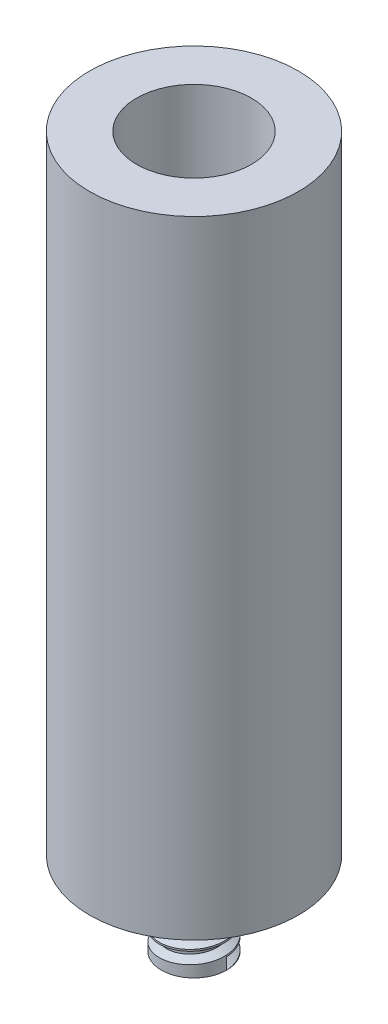
from build123d import *

# Parameters (mm, degrees)
FILETAGE1_PITCH = 1.27


with BuildPart() as part:
    # Esquisse1 → Revolve V1 (revolve)
    with BuildSketch(Plane.XY, mode=Mode.PRIVATE) as revolve_v1_sk:
        Polygon((0, 0), (0, 8), (-6.875, 8), (-6.875, 68), (-2.375, 68), (-2.375, 23), (3.125, 23), (3.125, 0), align=None)
    revolve(revolve_v1_sk.sketch.rotate(Axis((3.125, 0, 0), (0, 1, 0)), 270), axis=Axis((3.125, 0, 0), (0, 1, 0)))

    # Filetage1: arcs per turn and ends read off the stored shape
    # Filetage1: the profile of Profil de filetage1 profile screwed along a right-hand helix through 5.511814 turns, 8 arcs to a turn; built about Z, then put on its axis
    filetage1_z = Axis((0, 0, 0), (0, 0, 1))
    filetage1_corners = [(3.1253, 0, -0.000173205), (3.1253, 0, 1.111423202), (2.437592339, 0, 0.714374998), (2.437592339, 0, 0.396874998)]
    with BuildLine(mode=Mode.PRIVATE) as filetage1_profile:
        Line(filetage1_corners[0], filetage1_corners[1])
        Line(filetage1_corners[1], filetage1_corners[2])
        Line(filetage1_corners[2], filetage1_corners[3])
        Line(filetage1_corners[3], filetage1_corners[0])
    filetage1_cap = Face(filetage1_profile.wire())
    filetage1_turn_angles = [0, 22.5, 45, 67.5, 90, 112.5, 135, 157.5, 180, 202.5, 225, 247.5, 270, 292.5, 315, 337.5, 360]
    filetage1_turn_weights = [1, 0.9238795325112867, 1, 0.9238795325112867, 1, 0.9238795325112867, 1, 0.9238795325112867, 1, 0.9238795325112867, 1, 0.9238795325112867, 1, 0.9238795325112867, 1, 0.9238795325112867, 1]
    filetage1_turn_rails = [Edge.make_bspline([Vector(p[0], p[1], 0).rotate(filetage1_z, filetage1_turn_angles[k]) / filetage1_turn_weights[k] + Vector(0, 0, p[2] + FILETAGE1_PITCH * filetage1_turn_angles[k] / 360) for k in range(17)], [0, 0, 0, 1, 1, 2, 2, 3, 3, 4, 4, 5, 5, 6, 6, 7, 7, 8, 8, 8], 2, filetage1_turn_weights) for p in filetage1_corners]
    filetage1_turn_sides = [Face.make_surface_from_curves(filetage1_turn_rails[p[0]], filetage1_turn_rails[p[1]]) for p in [(0, 1), (1, 2), (2, 3), (3, 0)]]
    filetage1_last_angles = [1800, 1822.5, 1845, 1867.5, 1890, 1912.5, 1935, 1957.5, 1980, 1982.1265, 1984.253]
    filetage1_last_weights = [1, 0.9238795325112867, 1, 0.9238795325112867, 1, 0.9238795325112867, 1, 0.9238795325112867, 1, 0.9993113387280778, 1]
    filetage1_last_rails = [Edge.make_bspline([Vector(p[0], p[1], 0).rotate(filetage1_z, filetage1_last_angles[k]) / filetage1_last_weights[k] + Vector(0, 0, p[2] + FILETAGE1_PITCH * filetage1_last_angles[k] / 360) for k in range(11)], [0, 0, 0, 1, 1, 2, 2, 3, 3, 4, 4, 5, 5, 5], 2, filetage1_last_weights) for p in filetage1_corners]
    filetage1_last_sides = [Face.make_surface_from_curves(filetage1_last_rails[p[0]], filetage1_last_rails[p[1]]) for p in [(0, 1), (1, 2), (2, 3), (3, 0)]]
    filetage1 = Plane(origin=(3.125, 0, 0), x_dir=(1, 0, 0), z_dir=(0, 1, 0)) * Solid(Shell([*[p.moved(Location((0, 0, FILETAGE1_PITCH * i))) for i in range(5) for p in filetage1_turn_sides], *filetage1_last_sides, filetage1_cap, filetage1_cap.rotate(filetage1_z, 1984.253).moved(Location((0, 0, FILETAGE1_PITCH * 1984.253 / 360)))]))
    add(filetage1, mode=Mode.SUBTRACT)


solid = part.part
